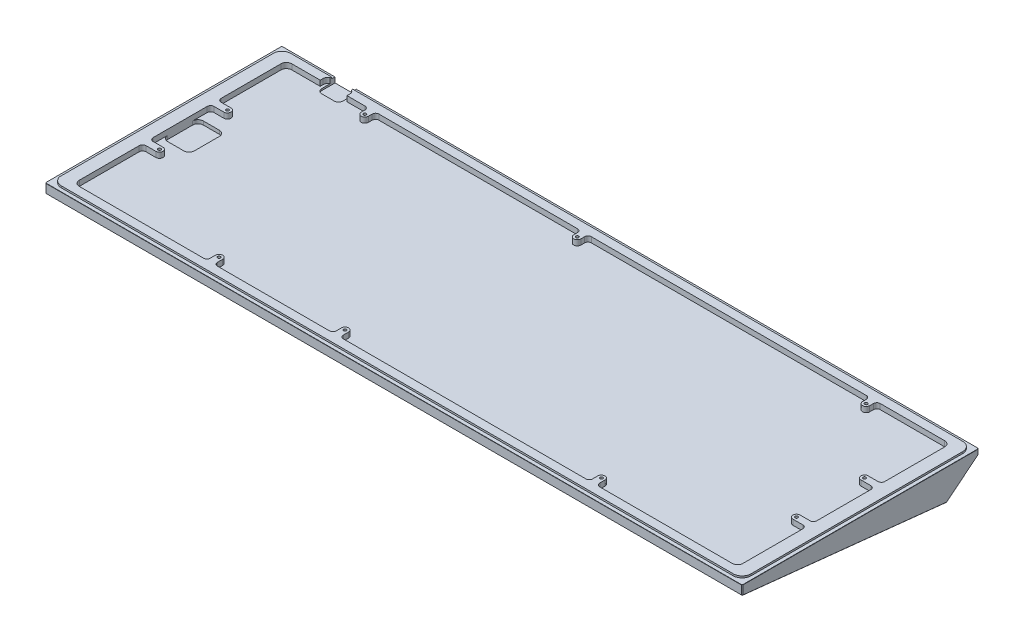
from build123d import *
from OCP.BRepFilletAPI import BRepFilletAPI_MakeChamfer

# Parameters (mm, degrees)
SKETCH1_W                 = 390.7
SKETCH1_H                 = 132.7
MAINBODY_DEPTH            = 18.5
SKETCH2_W                 = 390.7
SKETCH2_H                 = 132.7
SKETCH2_W_2               = 386.6
SKETCH2_H_2               = 128.6
ALIGMENTLIP_DEPTH         = 1
TYPINGANGLE_DEPTH         = 414.035143783
SKETCH4_W                 = 372
SKETCH4_H                 = 119.1
PCBCUTOUT_DEPTH           = 3
SKETCH13_W                = 15
SKETCH13_H                = 20
CUT_EXTRUDE4_DEPTH        = 2
FILLET2_R                 = 3
CHAMFER1_SIZE             = 0.5
CHAMFER1_SIZE_2           = 0.561801899
CHAMFER2_SIZE             = 0.1
SKETCH17_R                = 1
SKETCH17_W                = 2
SKETCH17_H                = 2
CUT_EXTRUDE5_DEPTH        = 1
SKETCH18_W                = 12
SKETCH18_H                = 4
CUT_EXTRUDE6_DEPTH        = 10
SKETCH12_W                = 15
SKETCH12_H                = 3.95
CUT_EXTRUDE3_DEPTH        = 3
FILLET1_R                 = 2.5
SKETCH19_R                = 2
SKETCH19_W                = 4
SKETCH19_H                = 4
SKETCH19_W_2              = 7.45
SKETCH19_H_2              = 4.8
BOSS_EXTRUDE1_DEPTH       = 3
FILLET3_R                 = 1.9
M2X0_4_TAPPED_HOLE1_D     = 1.6
M2X0_4_TAPPED_HOLE1_DEPTH = 4
M2X0_4_TAPPED_HOLE1_TIP   = 0.480688495
CHAMFER3_SIZE             = 0.1
FILLET4_R                 = 5


# Some blends are built 0.0001 mm under size
with BuildPart() as part:
    # Sketch1 → MainBody (new body)
    with BuildSketch(Plane(origin=(0, 0, 0), x_dir=(1, 0, 0), z_dir=(0, 1, 0))):
        with Locations((195.35, 66.35)):
            Rectangle(SKETCH1_W, SKETCH1_H)
    extrude(amount=MAINBODY_DEPTH)

    # Sketch2 → AligmentLip (cut)
    with BuildSketch(Plane(origin=(0, 18.5, 0), x_dir=(1, 0, 0), z_dir=(0, 1, 0))):
        with Locations((195.35, 66.35)):
            Rectangle(SKETCH2_W, SKETCH2_H)
        with Locations((195.35, 66.35)):
            Rectangle(SKETCH2_W_2, SKETCH2_H_2, mode=Mode.SUBTRACT)
    extrude(amount=-ALIGMENTLIP_DEPTH, mode=Mode.SUBTRACT)

    # Sketch3 → TypingAngle (cut, through all)
    with BuildSketch(Plane.ZY):
        Polygon((-114.79399123, 0), (-132.7, 14.5), (-132.7, 0), align=None)
        Polygon((0, 12.065334661), (-114.79399123, 0), (0, 0), align=None)
    extrude(amount=-TYPINGANGLE_DEPTH, mode=Mode.SUBTRACT)

    # Sketch4 → PCBCutout (cut)
    with BuildSketch(Plane(origin=(0, 18.5, 0), x_dir=(1, 0, 0), z_dir=(0, 1, 0))):
        with Locations((195.35, 66.35)):
            Rectangle(SKETCH4_W, SKETCH4_H)
    extrude(amount=-PCBCUTOUT_DEPTH, mode=Mode.SUBTRACT)

    # Sketch13 → Cut-Extrude4 (cut)
    with BuildSketch(Plane(origin=(0, 15.5, 0), x_dir=(1, 0, 0), z_dir=(0, 1, 0))):
        with Locations((16.85, 66.35)):
            Rectangle(SKETCH13_W, SKETCH13_H)
    extrude(amount=-CUT_EXTRUDE4_DEPTH, mode=Mode.SUBTRACT)

    # Fillet2
    fillet2_edges = [part.edges().sort_by_distance(p)[0] for p in [
        (9.35, 17, -6.8),
        (9.35, 17, -125.9),
        (381.35, 17, -125.9),
        (381.35, 17, -6.8),
        (9.35, 14.5, -56.35),
        (9.35, 14.5, -76.35),
        (24.35, 14.5, -76.35),
        (24.35, 14.5, -56.35),
    ]]
    fillet(fillet2_edges, radius=FILLET2_R)

    # Chamfer1
    chamfer1_edges_1 = [part.edges().sort_by_distance(p)[0] for p in [
        (0, 16, -132.7),
        (390.7, 16, -132.7),
        (390.7, 14.782667331, 0),
        (0, 14.782667331, 0),
        (0, 7.25, -123.746995615),
        (390.7, 7.25, -123.746995615),
        (0, 6.032667331, -57.396995615),
        (390.7, 6.032667331, -57.396995615),
    ]]
    chamfer1_edges_2 = [part.edges().sort_by_distance(p)[0] for p in [
        (195.35, 12.065334661, 0),
    ]]
    chamfer1_side_2 = [part.faces().sort_by_distance(p)[0] for p in [
        (195.35, 12.064289377, -0.009945219),
    ]]
    chamfer1 = BRepFilletAPI_MakeChamfer(part.part.solid().wrapped)
    for e in chamfer1_edges_1:
        chamfer1.Add(CHAMFER1_SIZE - 0.0001, e.wrapped)
    for e in chamfer1_edges_2:
        chamfer1.Add(CHAMFER1_SIZE_2 - 0.0001, CHAMFER1_SIZE - 0.0001, e.wrapped, chamfer1_side_2[0].wrapped)
    add(Compound.cast(chamfer1.Shape()), mode=Mode.REPLACE)  # a hair under: the kernel refuses the full size

    # Chamfer2
    chamfer2_edges = [part.edges().sort_by_distance(p)[0] for p in [
        (2.05, 18.5, -66.35),
    ]]
    chamfer(chamfer2_edges, length=CHAMFER2_SIZE)

    # Sketch17 → Cut-Extrude5 (cut)
    with BuildSketch(Plane(origin=(0, 11.933506406, -1.254262065), x_dir=(1, 0, 0), z_dir=(0, -0.9945218953682734, 0.10452846326765429))):
        with Locations((205.25, -52.238829109)):
            Circle(SKETCH17_R)
        with BuildLine():
            ThreePointArc((204.25, -52.238829109), (205.25, -51.238829109), (206.25, -52.238829109))
            Line((206.25, -52.238829109), (206.25, -49.738829109))
            ThreePointArc((206.25, -49.738829109), (205.25, -50.738829109), (204.25, -49.738829109))
            Line((204.25, -49.738829109), (204.25, -52.238829109))
        make_face()
        with Locations((205.25, -49.738829109)):
            Circle(SKETCH17_R)
        with Locations((201.75, -49.738829109)):
            Circle(SKETCH17_R)
        with BuildLine():
            ThreePointArc((200.75, -60.238829109), (201.75, -59.238829109), (202.75, -60.238829109))
            Line((202.75, -60.238829109), (202.75, -49.738829109))
            ThreePointArc((202.75, -49.738829109), (201.75, -50.738829109), (200.75, -49.738829109))
            Line((200.75, -49.738829109), (200.75, -60.238829109))
        make_face()
        with Locations((201.75, -60.238829109)):
            Circle(SKETCH17_R)
        with Locations((197.25, -53.738829109)):
            Circle(SKETCH17_R)
        with BuildLine():
            Line((196.25, -62.738829109), (198.25, -62.738829109))
            Line((198.25, -62.738829109), (198.25, -53.738829109))
            ThreePointArc((198.25, -53.738829109), (197.25, -54.738829109), (196.25, -53.738829109))
            Line((196.25, -53.738829109), (196.25, -62.738829109))
        make_face()
        with Locations((197.25, -63.738829109)):
            Rectangle(SKETCH17_W, SKETCH17_H)
        with BuildLine():
            ThreePointArc((196.25, -67.738829109), (197.25, -66.738829109), (198.25, -67.738829109))
            Line((198.25, -67.738829109), (198.25, -64.738829109))
            Line((198.25, -64.738829109), (196.25, -64.738829109))
            Line((196.25, -64.738829109), (196.25, -67.738829109))
        make_face()
        with Locations((197.25, -67.738829109)):
            Circle(SKETCH17_R)
        with BuildLine():
            Line((194.25, -64.738829109), (196.25, -64.738829109))
            Line((196.25, -64.738829109), (196.25, -62.738829109))
            Line((196.25, -62.738829109), (194.25, -62.738829109))
            ThreePointArc((194.25, -62.738829109), (194.957106781, -63.031722328), (195.25, -63.738829109))
            ThreePointArc((195.25, -63.738829109), (194.957106781, -64.44593589), (194.25, -64.738829109))
        make_face()
        with Locations((194.25, -63.738829109)):
            Circle(SKETCH17_R)
        with Locations(Location((201.75, -63.738829109, 0), (0, 0, 270))):
            Circle(SKETCH17_R)
        with Locations((192.45, -60.238829109)):
            Circle(SKETCH17_R)
        with BuildLine():
            ThreePointArc((191.45, -60.238829109), (192.45, -59.238829109), (193.45, -60.238829109))
            Line((193.45, -60.238829109), (193.45, -54.238829109))
            ThreePointArc((193.45, -54.238829109), (192.45, -55.238829109), (191.45, -54.238829109))
            Line((191.45, -54.238829109), (191.45, -60.238829109))
        make_face()
        with Locations((192.45, -54.238829109)):
            Circle(SKETCH17_R)
        with BuildLine():
            ThreePointArc((187.95, -60.238829109), (188.95, -59.238829109), (189.95, -60.238829109))
            Line((189.95, -60.238829109), (189.95, -54.238829109))
            ThreePointArc((189.95, -54.238829109), (188.95, -55.238829109), (187.95, -54.238829109))
            Line((187.95, -54.238829109), (187.95, -60.238829109))
        make_face()
        with Locations((188.95, -60.238829109)):
            Circle(SKETCH17_R)
        with Locations((188.95, -54.238829109)):
            Circle(SKETCH17_R)
        with Locations((185.45, -54.238829109)):
            Circle(SKETCH17_R)
        with BuildLine():
            ThreePointArc((184.45, -60.238829109), (185.45, -59.238829109), (186.45, -60.238829109))
            Line((186.45, -60.238829109), (186.45, -54.238829109))
            ThreePointArc((186.45, -54.238829109), (185.45, -55.238829109), (184.45, -54.238829109))
            Line((184.45, -54.238829109), (184.45, -60.238829109))
        make_face()
        with Locations((185.45, -60.238829109)):
            Circle(SKETCH17_R)
    extrude(amount=-CUT_EXTRUDE5_DEPTH, mode=Mode.SUBTRACT)

    # Sketch18 → Cut-Extrude6 (cut)
    with BuildSketch(Plane(origin=(0, 0, -132.7), x_dir=(-1, 0, 0), z_dir=(0, 0, -1))):
        with Locations((-35.8, 16.5)):
            Rectangle(SKETCH18_W, SKETCH18_H)
    extrude(amount=-CUT_EXTRUDE6_DEPTH, mode=Mode.SUBTRACT)

    # Sketch12 → Cut-Extrude3 (cut)
    with BuildSketch(Plane(origin=(0, 18.5, 0), x_dir=(1, 0, 0), z_dir=(0, 1, 0))):
        with Locations((35.8, 127.875)):
            Rectangle(SKETCH12_W, SKETCH12_H)
    extrude(amount=-CUT_EXTRUDE3_DEPTH, mode=Mode.SUBTRACT)

    # Fillet1
    # the kernel refuses this fillet: 2.5 mm, written as the material it adds along each edge
    with BuildSketch(Plane(origin=(43.3, 18.5, -129.85), x_dir=(-1, 0, 0), z_dir=(0, -1, 0))) as fillet1_piece_1_section:
        with BuildLine():
            CenterArc((2.5, -2.291287847), FILLET1_R, 113.578178478, 66.421821522)
            Line((0, -2.291287847), (0, 0))
            Line((0, 0), (1.5, 0))
        make_face()
    fillet1_piece_1 = extrude(amount=8.728219619, mode=Mode.PRIVATE)
    fillet1_piece_1 = split(fillet1_piece_1, bisect_by=Plane(origin=(42.895833366, 13.646672466, -131.646228254), z_dir=(0, 0.7771459614569701, 0.6293203910498384)), keep=Keep.TOP, mode=Mode.PRIVATE)
    add(fillet1_piece_1)
    with BuildSketch(Plane(origin=(28.3, 18.5, -129.85), x_dir=(0, 0, 1), z_dir=(0, -1, 0))) as fillet1_piece_2_section:
        with BuildLine():
            CenterArc((2.291287847, -2.5), FILLET1_R, 90, 66.421821522)
            Line((0, -1.5), (0, 0))
            Line((0, 0), (2.291287847, 0))
        make_face()
    fillet1_piece_2 = extrude(amount=8.728219619, mode=Mode.PRIVATE)
    fillet1_piece_2 = split(fillet1_piece_2, bisect_by=Plane(origin=(28.704166634, 13.646672466, -131.646228254), z_dir=(0, 0.7771459614569701, 0.6293203910498384)), keep=Keep.TOP, mode=Mode.PRIVATE)
    add(fillet1_piece_2)
    with BuildSketch(Plane(origin=(41.8, 8.25, -122.7), x_dir=(0, 0, -1), z_dir=(0, 1, 0))) as fillet1_piece_3_section:
        with BuildLine():
            CenterArc((FILLET1_R, FILLET1_R), FILLET1_R, 180, 90)
            Line((0, FILLET1_R), (0, 0))
            Line((0, 0), (FILLET1_R, 0))
        make_face()
    fillet1_piece_3 = extrude(amount=7.25, mode=Mode.PRIVATE)
    fillet1_piece_3 = split(fillet1_piece_3, bisect_by=Plane(origin=(41.241580153, 10.080392591, -127.242239377), z_dir=(0, 0.7771459614569701, 0.6293203910498384)), keep=Keep.TOP, mode=Mode.PRIVATE)
    add(fillet1_piece_3)
    with BuildSketch(Plane(origin=(29.8, 15.5, -122.7), x_dir=(1, 0, 0), z_dir=(0, -1, 0))) as fillet1_piece_4_section:
        with BuildLine():
            CenterArc((FILLET1_R, -FILLET1_R), FILLET1_R, 90, 90)
            Line((0, -FILLET1_R), (0, 0))
            Line((0, 0), (FILLET1_R, 0))
        make_face()
    fillet1_piece_4 = extrude(amount=7.25, mode=Mode.PRIVATE)
    fillet1_piece_4 = split(fillet1_piece_4, bisect_by=Plane(origin=(30.358419847, 10.080392591, -127.242239377), z_dir=(0, 0.7771459614569701, 0.6293203910498384)), keep=Keep.TOP, mode=Mode.PRIVATE)
    add(fillet1_piece_4)

    # Sketch19 → Boss-Extrude1 (add)
    with BuildSketch(Plane(origin=(0, 15.5, 0), x_dir=(1, 0, 0), z_dir=(0, 1, 0))):
        with Locations((57.3, 121.9)):
            Circle(SKETCH19_R)
        with Locations((176.4, 121.9)):
            Circle(SKETCH19_R)
        with Locations((338.3, 121.9)):
            Circle(SKETCH19_R)
        with Locations((16.8, 85.4)):
            Circle(SKETCH19_R)
        with Locations((16.8, 47.3)):
            Circle(SKETCH19_R)
        with Locations((85.9, 11.6)):
            Circle(SKETCH19_R)
        with Locations((156.5, 11.6)):
            Circle(SKETCH19_R)
        with Locations((300.2, 11.6)):
            Circle(SKETCH19_R)
        with Locations((373.9, 85.4)):
            Circle(SKETCH19_R)
        with Locations((373.9, 47.3)):
            Circle(SKETCH19_R)
        with Locations((57.3, 123.9)):
            Rectangle(SKETCH19_W, SKETCH19_H)
        with Locations((176.4, 123.9)):
            Rectangle(SKETCH19_W, SKETCH19_H)
        with Locations((338.3, 123.9)):
            Rectangle(SKETCH19_W, SKETCH19_H)
        with Locations((377.625, 85.4)):
            Rectangle(SKETCH19_W_2, SKETCH19_H)
        with Locations((377.625, 47.3)):
            Rectangle(SKETCH19_W_2, SKETCH19_H)
        with Locations((300.2, 9.2)):
            Rectangle(SKETCH19_W, SKETCH19_H_2)
        with Locations((156.5, 9.2)):
            Rectangle(SKETCH19_W, SKETCH19_H_2)
        with Locations((85.9, 9.2)):
            Rectangle(SKETCH19_W, SKETCH19_H_2)
        with Locations((13.075, 47.3)):
            Rectangle(SKETCH19_W_2, SKETCH19_H)
        with Locations((13.075, 85.4)):
            Rectangle(SKETCH19_W_2, SKETCH19_H)
    extrude(amount=BOSS_EXTRUDE1_DEPTH)

    # Fillet3
    fillet3_edges = [part.edges().sort_by_distance(p)[0] for p in [
        (9.35, 17, -87.4),
        (9.35, 17, -83.4),
        (178.4, 17, -125.9),
        (174.4, 17, -125.9),
        (381.35, 17, -87.4),
        (381.35, 17, -83.4),
        (298.2, 17, -6.8),
        (302.2, 17, -6.8),
        (87.9, 17, -6.8),
        (83.9, 17, -6.8),
        (154.5, 17, -6.8),
        (158.5, 17, -6.8),
        (381.35, 17, -49.3),
        (381.35, 17, -45.3),
        (340.3, 17, -125.9),
        (336.3, 17, -125.9),
        (59.3, 17, -125.9),
        (55.3, 17, -125.9),
        (9.35, 17, -49.3),
        (9.35, 17, -45.3),
    ]]
    fillet(fillet3_edges, radius=FILLET3_R)

    # M2x0.4 Tapped Hole1
    with Locations(Plane(origin=(57.3, 18.5, -121.9), x_dir=(0, 0, 1), z_dir=(0, 1, 0))):
        with Locations((0, 0), (0, 119.1), (74.6, -40.5), (36.5, -40.5), (110.3, 28.6), (110.3, 99.2), (110.3, 242.9), (74.6, 316.6), (36.5, 316.6), (0, 281)):
            Hole(M2X0_4_TAPPED_HOLE1_D / 2, depth=M2X0_4_TAPPED_HOLE1_DEPTH)
            with Locations((0, 0, -(M2X0_4_TAPPED_HOLE1_DEPTH + M2X0_4_TAPPED_HOLE1_TIP / 2))):  # 118° drill point
                Cone(0, M2X0_4_TAPPED_HOLE1_D / 2, M2X0_4_TAPPED_HOLE1_TIP, mode=Mode.SUBTRACT)

    # Chamfer3
    chamfer3_edges = [part.edges().sort_by_distance(p)[0] for p in [
        (195.35, 17.5, 0),
        (216.00005, 17.5, -132.7),
        (390.7, 17.5, -66.35),
        (0, 17.5, -66.35),
        (15.14995, 17.5, -132.7),
    ]]
    chamfer(chamfer3_edges, length=CHAMFER3_SIZE)

    # Fillet4
    fillet4_edges = [part.edges().sort_by_distance(p)[0] for p in [
        (388.65, 18, -2.05),
        (388.65, 18, -130.65),
        (2.05, 17.95, -2.05),
        (2.05, 17.95, -130.65),
    ]]
    fillet(fillet4_edges, radius=FILLET4_R)


solid = part.part
